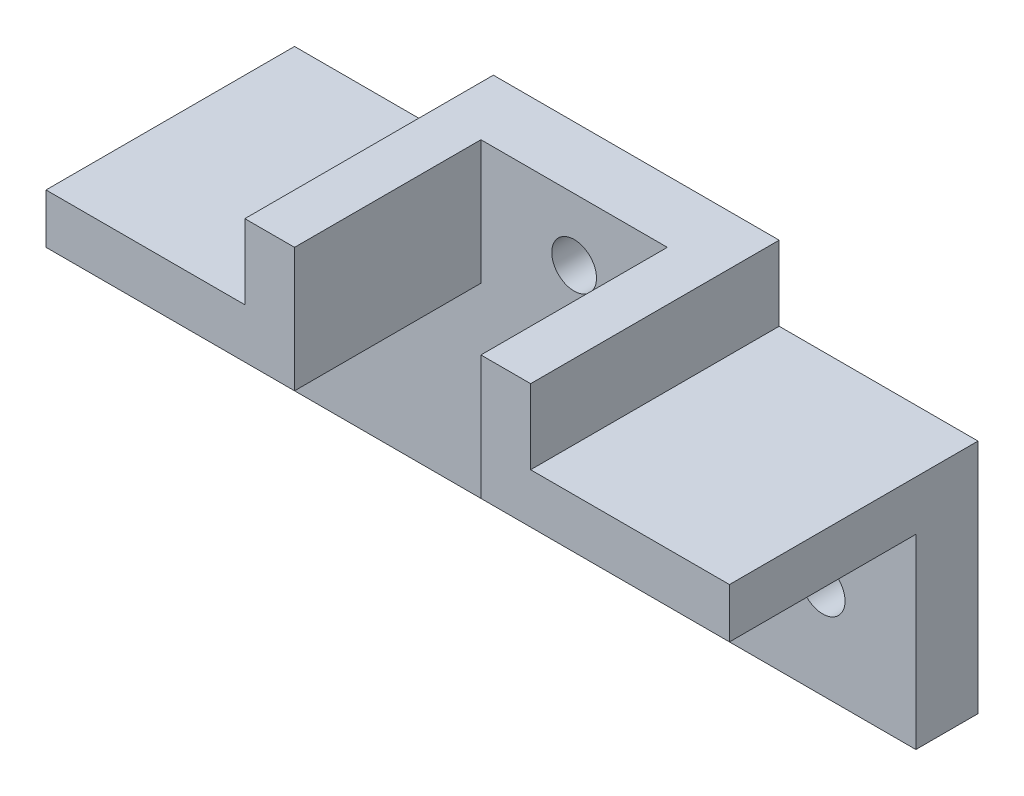
from build123d import *

# Parameters (mm, degrees)
BOSS_EXTRUDE1_DEPTH = 5
BOSS_EXTRUDE2_DEPTH = 20
SKETCH6_R           = 1.8
CUT_EXTRUDE3_DEPTH  = 41.620576534


with BuildPart() as part:
    # Sketch1 → Boss-Extrude1 (new body)
    with BuildSketch(Plane.XY):
        Polygon((14.31372549, 5.735294118), (34.31372549, 5.735294118), (34.31372549, -9.264705882), (-20.68627451, -9.264705882), (-20.68627451, 5.735294118), (-0.68627451, 5.735294118), (-0.68627451, 15.735294118), (14.31372549, 15.735294118), align=None)
    extrude(amount=BOSS_EXTRUDE1_DEPTH)

    # Sketch2 → Boss-Extrude2 (add)
    with BuildSketch(Plane(origin=(0, 0, 0), x_dir=(-1, 0, 0), z_dir=(0, 0, -1))):
        Polygon((0.68627451, 15.735294118), (4.68627451, 15.735294118), (4.68627451, 9.735294118), (6.079970528, 9.735294118), (20.68627451, 9.735294118), (20.68627451, 5.735294118), (0.68627451, 5.735294118), align=None)
    boss_extrude2 = extrude(amount=-BOSS_EXTRUDE2_DEPTH)

    # Mirror1: Boss-Extrude2 across plane
    add(boss_extrude2.mirror(Plane.ZY.offset(-6.81372549)))

    # Sketch6 → Cut-Extrude3 (cut, through all)
    with BuildSketch(Plane.XY.offset(5)):
        with Locations((6.81372549, 10.735294118)):
            Circle(SKETCH6_R)
        with Locations((-13.18627451, -1.764705882)):
            Circle(SKETCH6_R)
        with Locations((26.81372549, -1.764705882)):
            Circle(SKETCH6_R)
    extrude(amount=-CUT_EXTRUDE3_DEPTH, mode=Mode.SUBTRACT)


solid = part.part
